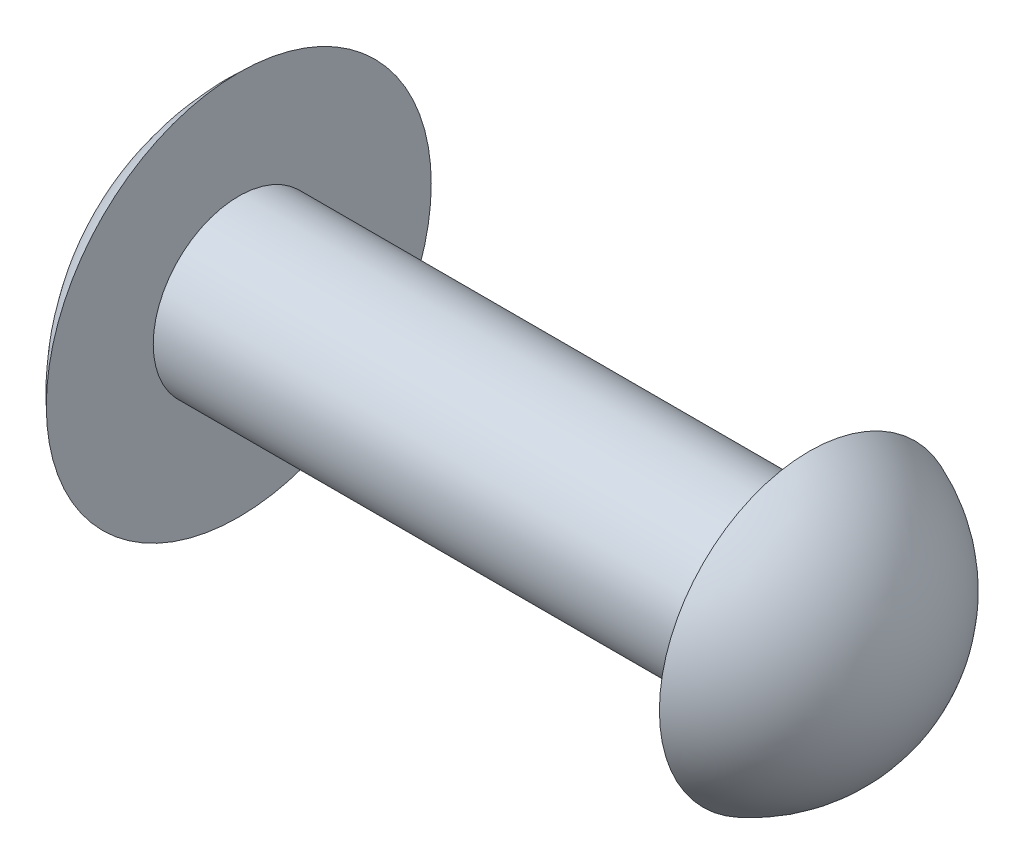
from build123d import *


with BuildPart() as part:
    # Sketch1 → Base-Revolve (revolve)
    with BuildSketch(Plane.XY):
        with BuildLine():
            Line((-23, 0), (0, 0))
            Line((0, 0), (0, 3))
            Line((0, 3), (-20, 3))
            Line((-20, 3), (-20, 6.75))
            ThreePointArc((-20, 6.75), (-22.21622377, 3.693321676), (-23, 0))
        make_face()
    revolve(axis=Axis((-39, 0, 0), (1, 0, 0)))

    # Sketch2 → HeadTypeA (revolve)
    with BuildSketch(Plane.XY):
        with BuildLine():
            Line((0, 0), (3.6, 0))
            ThreePointArc((3.6, 0), (2.613552069, 3.182864276), (0, 5.25))
            Line((0, 5.25), (0, 0))
        make_face()
    revolve(axis=Axis((-49, 0, 0), (1, 0, 0)))


solid = part.part
